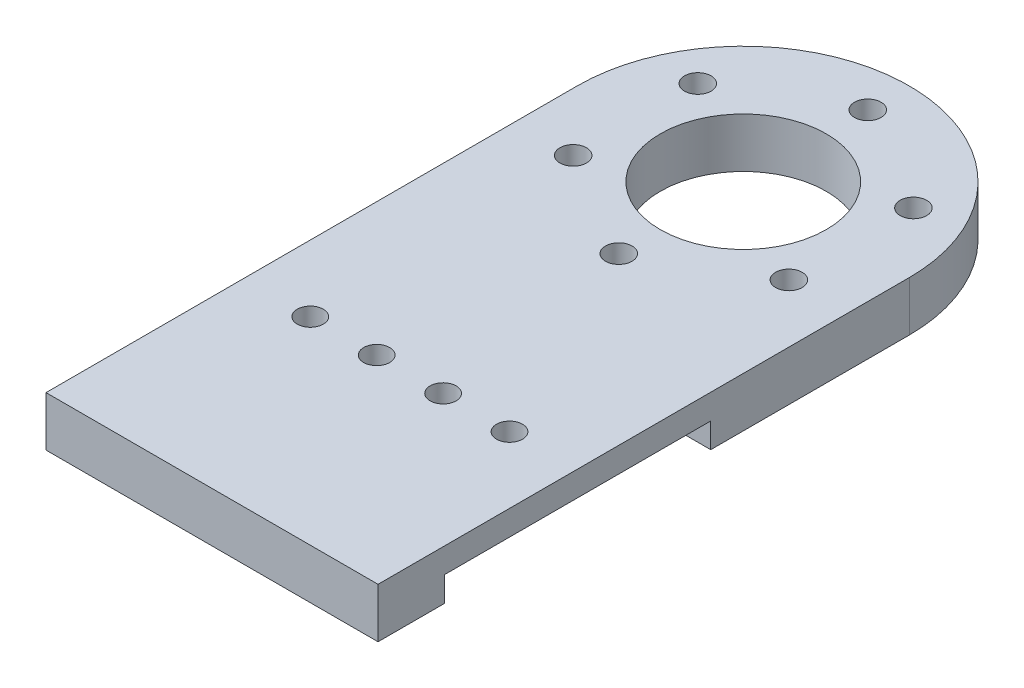
from build123d import *

# Parameters (mm, degrees)
SKETCH1_R           = 2.4892
SKETCH1_R_2         = 15.875
BOSS_EXTRUDE2_DEPTH = 9.525
SKETCH1_3_W         = 63.5
SKETCH1_3_H         = 50.927
SKETCH1_3_R         = 2.4892
BOSS_EXTRUDE3_DEPTH = 3.175
SKETCH2_R           = 2.54
CUT_EXTRUDE1_DEPTH  = 140.646776131
SKETCH1_7_W         = 63.5
SKETCH1_7_H         = 50.927
SKETCH1_7_R         = 2.4892
CUT_EXTRUDE7_DEPTH  = 4.7625


with BuildPart() as part:
    # Sketch1 → Boss-Extrude2 (new body)
    with BuildSketch(Plane(origin=(0, 0, 0), x_dir=(1, 0, 0), z_dir=(0, 1, 0))):
        with BuildLine():
            Line((0, -124.009057971), (63.5, -124.009057971))
            Line((63.5, -124.009057971), (63.5, -22.409057971))
            ThreePointArc((63.5, -22.409057971), (31.75, 9.340942029), (0, -22.409057971))
            Line((0, -22.409057971), (0, -124.009057971))
        make_face()
        with Locations((12.7, -86.163057971)):
            Circle(SKETCH1_R, mode=Mode.SUBTRACT)
        with Locations((25.4, -86.163057971)):
            Circle(SKETCH1_R, mode=Mode.SUBTRACT)
        with Locations((38.1, -86.163057971)):
            Circle(SKETCH1_R, mode=Mode.SUBTRACT)
        with Locations((50.8, -86.163057971)):
            Circle(SKETCH1_R, mode=Mode.SUBTRACT)
        with Locations((31.75, -22.409057971)):
            Circle(SKETCH1_R_2, mode=Mode.SUBTRACT)
    extrude(amount=BOSS_EXTRUDE2_DEPTH)

    # Sketch1<3> → Boss-Extrude3 (add)
    with BuildSketch(Plane(origin=(0, 0, 0), x_dir=(1, 0, 0), z_dir=(0, 1, 0))):
        with Locations((31.75, -85.845557971)):
            Rectangle(SKETCH1_3_W, SKETCH1_3_H)
        with Locations((12.7, -86.163057971)):
            Circle(SKETCH1_3_R, mode=Mode.SUBTRACT)
        with Locations((25.4, -86.163057971)):
            Circle(SKETCH1_3_R, mode=Mode.SUBTRACT)
        with Locations((38.1, -86.163057971)):
            Circle(SKETCH1_3_R, mode=Mode.SUBTRACT)
        with Locations((50.8, -86.163057971)):
            Circle(SKETCH1_3_R, mode=Mode.SUBTRACT)
    extrude(amount=BOSS_EXTRUDE3_DEPTH)

    # Sketch2 → Cut-Extrude1 (cut, through all)
    with BuildSketch(Plane.XZ):
        with Locations((11.1252, 34.310855365)):
            Circle(SKETCH2_R)
        with Locations((52.3748, 34.310855365)):
            Circle(SKETCH2_R)
        with Locations((11.137680759, 10.485658634)):
            Circle(SKETCH2_R)
        with Locations((52.362319241, 10.485658634)):
            Circle(SKETCH2_R)
        with Locations((31.75, 46.221557971)):
            Circle(SKETCH2_R)
        with Locations((31.75, -1.403442029)):
            Circle(SKETCH2_R)
    extrude(amount=-CUT_EXTRUDE1_DEPTH, mode=Mode.SUBTRACT)

    # Sketch1<7> → Cut-Extrude7 (cut)
    with BuildSketch(Plane(origin=(0, 0, 0), x_dir=(1, 0, 0), z_dir=(0, 1, 0))):
        with Locations((31.75, -85.845557971)):
            Rectangle(SKETCH1_7_W, SKETCH1_7_H)
        with Locations((12.7, -86.163057971)):
            Circle(SKETCH1_7_R, mode=Mode.SUBTRACT)
        with Locations((25.4, -86.163057971)):
            Circle(SKETCH1_7_R, mode=Mode.SUBTRACT)
        with Locations((38.1, -86.163057971)):
            Circle(SKETCH1_7_R, mode=Mode.SUBTRACT)
        with Locations((50.8, -86.163057971)):
            Circle(SKETCH1_7_R, mode=Mode.SUBTRACT)
    extrude(amount=CUT_EXTRUDE7_DEPTH, mode=Mode.SUBTRACT)


solid = part.part
